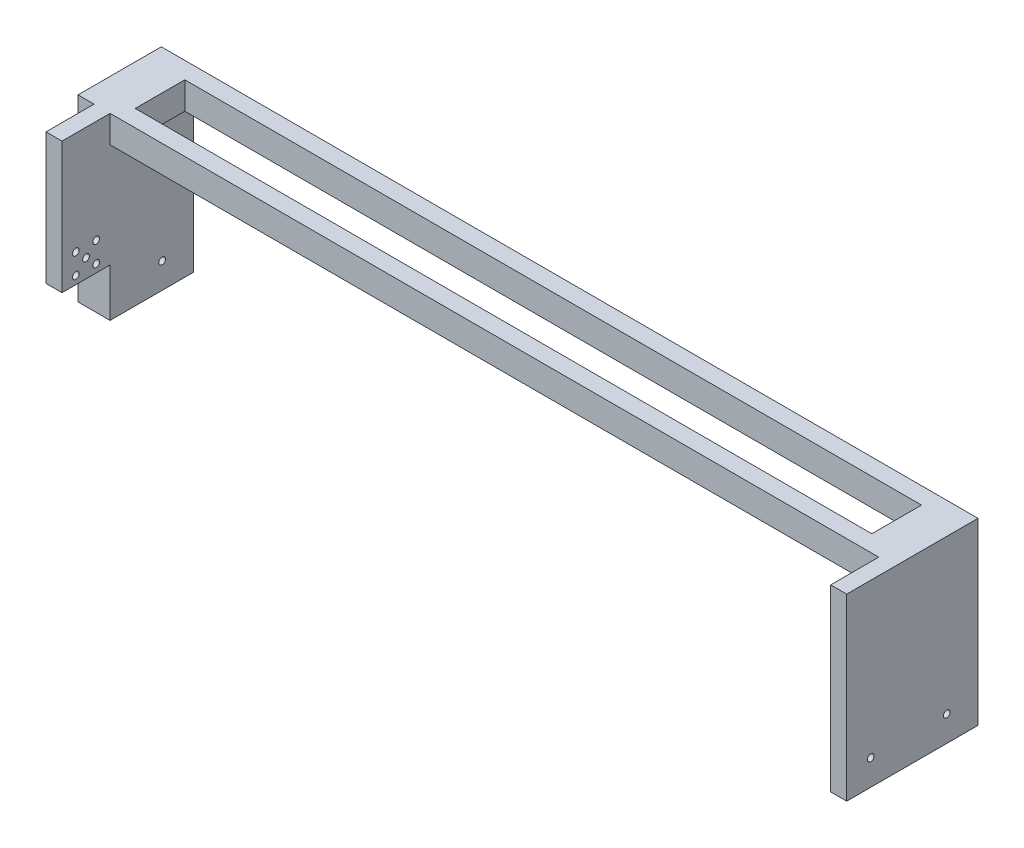
from build123d import *

# Parameters (mm, degrees)
BOSS_EXTRUDE1_DEPTH      = 82
BOSS_EXTRUDE1_DEPTH_BACK = 0.001
SKETCH2_W                = 480
SKETCH2_H                = 65
CUT_EXTRUDE2_DEPTH       = 82
SKETCH3_W                = 20
SKETCH3_H                = 52
SKETCH3_W_2              = 10
SKETCH3_H_2              = 82
BOSS_EXTRUDE3_DEPTH      = 30
SKETCH4_R                = 2.1
CUT_EXTRUDE3_DEPTH       = 618
SKETCH5_W                = 460
SKETCH5_H                = 31
CUT_EXTRUDE4_DEPTH       = 42
SKETCH6_R                = 2.1
CUT_EXTRUDE5_DEPTH       = 10


with BuildPart() as part:
    # Sketch1 → Boss-Extrude1 (new, two sides: drawn at the far end of the back side and taken through both)
    with BuildSketch(Plane(origin=(0, 0, 0), x_dir=(1, 0, 0), z_dir=(0, 1, 0)).offset(-BOSS_EXTRUDE1_DEPTH_BACK)):
        Polygon((10, -82), (10, -52), (0, -52), (0, 0), (510, 0), (510, -82), (500, -82), (500, -52), (20, -52), (20, -82), align=None)
    extrude(amount=BOSS_EXTRUDE1_DEPTH + BOSS_EXTRUDE1_DEPTH_BACK)

    # Sketch2 → Cut-Extrude2 (cut)
    with BuildSketch(Plane.XY):
        with Locations((260, 32.499)):
            Rectangle(SKETCH2_W, SKETCH2_H)
    extrude(amount=CUT_EXTRUDE2_DEPTH, mode=Mode.SUBTRACT)

    # Sketch3 → Boss-Extrude3 (add)
    with BuildSketch(Plane(origin=(0, 0, 0), x_dir=(1, 0, 0), z_dir=(0, 1, 0))):
        with Locations((10, -26)):
            Rectangle(SKETCH3_W, SKETCH3_H)
        with Locations((505, -41)):
            Rectangle(SKETCH3_W_2, SKETCH3_H_2)
    extrude(amount=-BOSS_EXTRUDE3_DEPTH)

    # Sketch4 → Cut-Extrude3 (cut)
    with BuildSketch(Plane(origin=(510, 0, 0), x_dir=(0, 0, -1), z_dir=(1, 0, 0))):
        with Locations((-67, -14.051)):
            Circle(SKETCH4_R)
        with Locations((-19.50000001, -14.05)):
            Circle(SKETCH4_R)
    extrude(amount=-CUT_EXTRUDE3_DEPTH, mode=Mode.SUBTRACT)

    # Sketch5 → Cut-Extrude4 (cut)
    with BuildSketch(Plane(origin=(0, 82, 0), x_dir=(1, 0, 0), z_dir=(0, 1, 0))):
        with Locations((255.2, -26)):
            Rectangle(SKETCH5_W, SKETCH5_H)
    extrude(amount=-CUT_EXTRUDE4_DEPTH, mode=Mode.SUBTRACT)

    # Sketch6 → Cut-Extrude5 (cut)
    with BuildSketch(Plane(origin=(20, 0, 0), x_dir=(0, 0, -1), z_dir=(1, 0, 0))):
        with Locations((-67, 11.349)):
            Circle(SKETCH6_R)
        with Locations((-60.65, 17.699)):
            Circle(SKETCH6_R)
        with Locations((-73.35, 17.699)):
            Circle(SKETCH6_R)
        with Locations((-73.35, 4.999)):
            Circle(SKETCH6_R)
        with Locations((-60.65, 4.999)):
            Circle(SKETCH6_R)
    extrude(amount=-CUT_EXTRUDE5_DEPTH, mode=Mode.SUBTRACT)


solid = part.part
